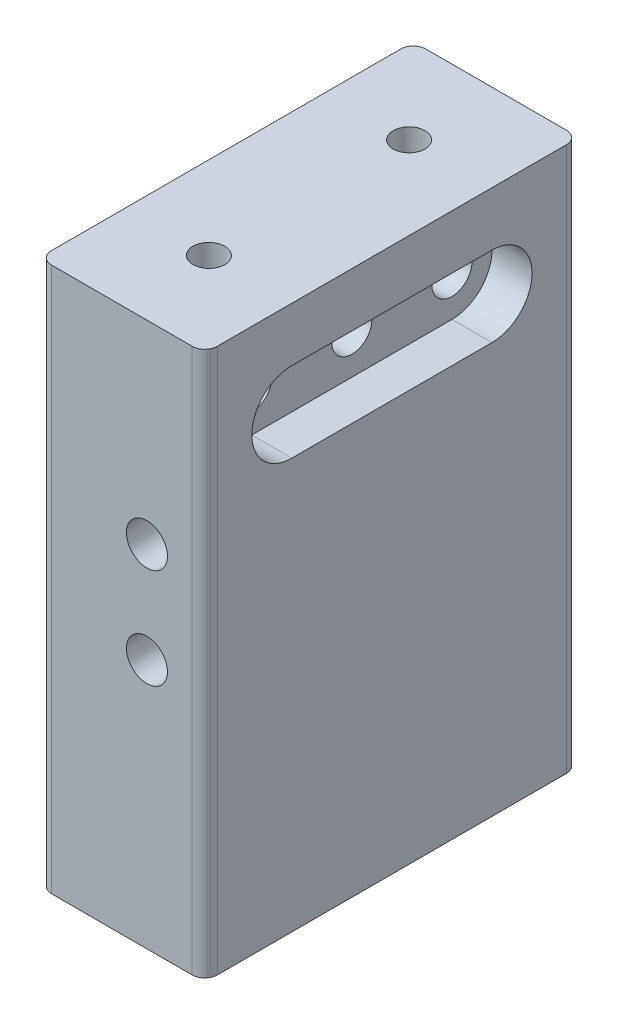
from build123d import *

# Parameters (mm, degrees)
SKETCH1_W           = 21.0312
SKETCH1_H           = 47.4853
BOSS_EXTRUDE1_DEPTH = 31.75
SKETCH2_R           = 2.6035
CUT_EXTRUDE1_DEPTH  = 59.081787674
SKETCH4_R           = 2.5527
CUT_EXTRUDE3_DEPTH  = 45.878584007
FILLET1_R           = 1.5875
CUT_EXTRUDE5_DEPTH  = 5.08
BOSS_EXTRUDE2_DEPTH = 5.588
SKETCH9_R           = 2.0193
CUT_EXTRUDE6_DEPTH  = 5.08


with BuildPart() as part:
    # Sketch1 → Boss-Extrude1 (new, symmetric)
    with BuildSketch(Plane(origin=(0, 0, 0), x_dir=(1, 0, 0), z_dir=(0, 1, 0))):
        Rectangle(SKETCH1_W, SKETCH1_H)
    extrude(amount=BOSS_EXTRUDE1_DEPTH, both=True)

    # Sketch2 → Cut-Extrude1 (cut, through all)
    with BuildSketch(Plane.XY.offset(23.74265)):
        with Locations((3.175, 0)):
            Circle(SKETCH2_R)
        with Locations((3.175, 12.7)):
            Circle(SKETCH2_R)
    extrude(amount=-CUT_EXTRUDE1_DEPTH, mode=Mode.SUBTRACT)

    # Sketch4 → Cut-Extrude3 (cut, through all)
    with BuildSketch(Plane(origin=(10.5156, 0, 0), x_dir=(0, 0, -1), z_dir=(1, 0, 0))):
        with Locations((-12.7, 25.4)):
            Circle(SKETCH4_R)
        with Locations((12.7, 25.4)):
            Circle(SKETCH4_R)
        with Locations((0, 25.4)):
            Circle(SKETCH4_R)
    extrude(amount=-CUT_EXTRUDE3_DEPTH, mode=Mode.SUBTRACT)

    # Fillet1
    fillet1_edges = [part.edges().sort_by_distance(p)[0] for p in [
        (10.5156, 0, 23.74265),
        (-10.5156, 0, 23.74265),
        (-10.5156, 0, -23.74265),
        (10.5156, 0, -23.74265),
    ]]
    fillet(fillet1_edges, radius=FILLET1_R)

    # Sketch7 → Cut-Extrude5 (cut)
    with BuildSketch(Plane(origin=(10.5156, 0, 0), x_dir=(0, 0, -1), z_dir=(1, 0, 0))):
        with BuildLine():
            Line((-12.7, 30.48), (12.7, 30.48))
            ThreePointArc((12.7, 30.48), (17.78, 25.4), (12.7, 20.32))
            Line((12.7, 20.32), (-12.7, 20.32))
            ThreePointArc((-12.7, 20.32), (-17.78, 25.4), (-12.7, 30.48))
        make_face()
    extrude(amount=-CUT_EXTRUDE5_DEPTH, mode=Mode.SUBTRACT)

    # Sketch8 → Boss-Extrude2 (add)
    with BuildSketch(Plane(origin=(0, 31.75, 0), x_dir=(1, 0, 0), z_dir=(0, 1, 0))):
        with BuildLine():
            Line((-8.9281, -23.74265), (8.9281, -23.74265))
            ThreePointArc((8.9281, -23.74265), (10.050632015, -23.277682015), (10.5156, -22.15515))
            Line((10.5156, -22.15515), (10.5156, 22.15515))
            ThreePointArc((10.5156, 22.15515), (10.050632015, 23.277682015), (8.9281, 23.74265))
            Line((8.9281, 23.74265), (-8.9281, 23.74265))
            ThreePointArc((-8.9281, 23.74265), (-10.050632015, 23.277682015), (-10.5156, 22.15515))
            Line((-10.5156, 22.15515), (-10.5156, -22.15515))
            ThreePointArc((-10.5156, -22.15515), (-10.050632015, -23.277682015), (-8.9281, -23.74265))
        make_face()
    extrude(amount=BOSS_EXTRUDE2_DEPTH)

    # Sketch9 → Cut-Extrude6 (cut)
    with BuildSketch(Plane(origin=(0, 37.338, 0), x_dir=(1, 0, 0), z_dir=(0, 1, 0))):
        with Locations((0, 12.7)):
            Circle(SKETCH9_R)
        with Locations((0, -12.7)):
            Circle(SKETCH9_R)
    extrude(amount=-CUT_EXTRUDE6_DEPTH, mode=Mode.SUBTRACT)


solid = part.part
